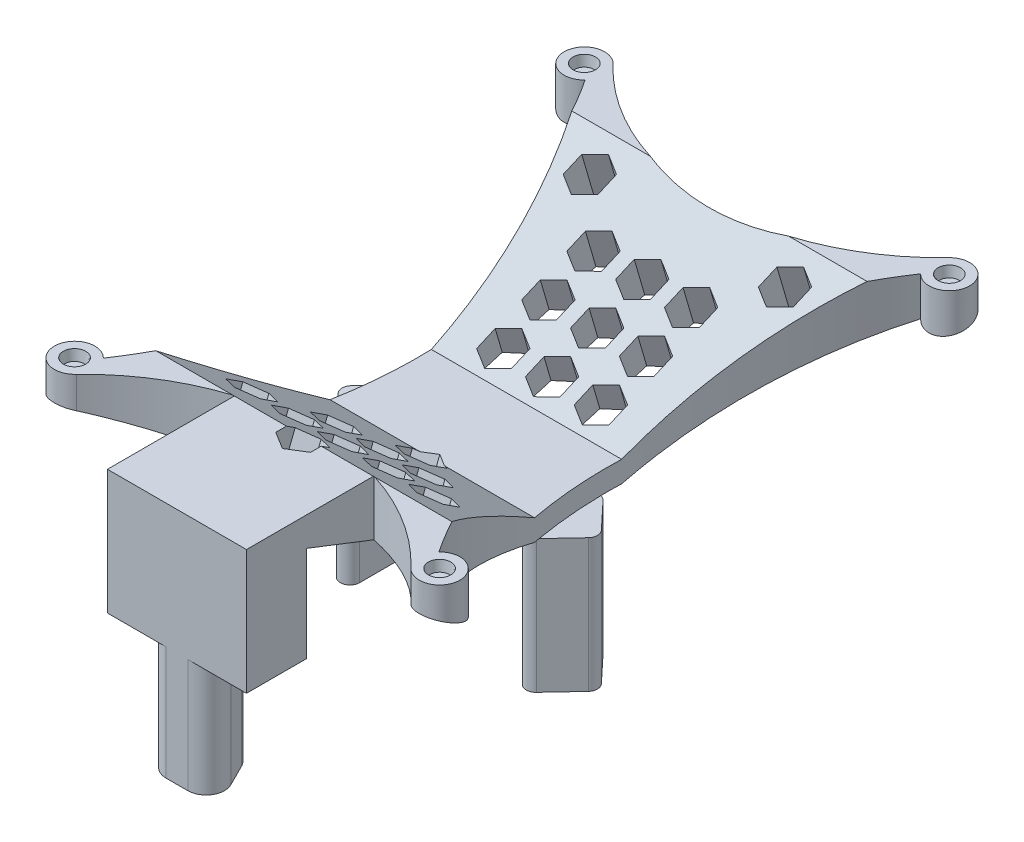
from build123d import *
from build123d.topology import SkipClean

# Parameters (mm, degrees)
BOSS_EXTRUDE1_DEPTH          = 36.5
CUT_EXTRUDE1_DEPTH           = 98.865031656
SKETCH4_R                    = 1.935
CUT_EXTRUDE2_DEPTH           = 1.7526
CUT_EXTRUDE2_DRAFT           = -8
CUT_EXTRUDE2_PROFILE_2_DEPTH = 1.7526
CUT_EXTRUDE2_PROFILE_2_DRAFT = -8
CUT_EXTRUDE2_PROFILE_3_DEPTH = 1.7526
CUT_EXTRUDE2_PROFILE_3_DRAFT = -8
CUT_EXTRUDE2_PROFILE_4_DEPTH = 1.7526
CUT_EXTRUDE2_PROFILE_4_DRAFT = -8
BOSS_EXTRUDE2_DEPTH          = 4.6228
FILLET1_R                    = 3.175
CUT_EXTRUDE4_START           = -15
CUT_EXTRUDE4_DEPTH           = 15
CUT_EXTRUDE6_DEPTH           = 50
CUT_EXTRUDE7_DEPTH           = 100
FILL_START                   = 16.923311585
FILL_PATTERN1_DEPTH          = 7.757240099
CUT_EXTRUDE8_DEPTH           = 100
FILL_START_2                 = 12.114170934
FILL_PATTERN2_DEPTH          = 8.855811696
BOSS_EXTRUDE4_DEPTH          = 22.982825762
FILLET2_R                    = 1.651


# Read off the part's stored shape, not the designer's step: Fill Pattern1, Fill Pattern2
with BuildPart() as part:
    # Sketch1 → Boss-Extrude1 (new body)
    with BuildSketch(Plane(origin=(0, 0, 0), x_dir=(1, 0, 0), z_dir=(0, 1, 0))):
        with BuildLine():
            Line((-12, -35.838693114), (-12, -57.838693114))
            Line((-12, -57.838693114), (12, -57.838693114))
            Line((12, -57.838693114), (12, -35.838693114))
            ThreePointArc((12, -35.838693114), (21.100135224, -40.014143909), (28.878256635, -46.318719847))
            ThreePointArc((28.878256635, -46.318719847), (34.99938562, -44.065576529), (28.966969845, -41.584682581))
            ThreePointArc((28.966969845, -41.584682581), (16.382626331, 0), (28.966969845, 41.584682581))
            ThreePointArc((28.966969845, 41.584682581), (34.998690641, 44.095727727), (28.838687388, 46.273194928))
            ThreePointArc((28.838687388, 46.273194928), (0, 33.991963114), (-28.838687388, 46.273194928))
            ThreePointArc((-28.838687388, 46.273194928), (-34.998690641, 44.095727727), (-28.966969845, 41.584682581))
            ThreePointArc((-28.966969845, 41.584682581), (-16.382626331, 0), (-28.966969845, -41.584682581))
            ThreePointArc((-28.966969845, -41.584682581), (-34.99938562, -44.065576529), (-28.878256635, -46.318719847))
            ThreePointArc((-28.878256635, -46.318719847), (-21.100135224, -40.014143909), (-12, -35.838693114))
        make_face()
    extrude(amount=BOSS_EXTRUDE1_DEPTH)

    # Sketch2 → Cut-Extrude1 (cut, through all)
    with BuildSketch(Plane(origin=(35, 0, 0), x_dir=(0, 0, -1), z_dir=(1, 0, 0))):
        Polygon((47.5, 31.5), (47.5, 18.360025762), (47.5, 0), (-3.679030534, 0), (-47.5, 0), (-47.5, 18.360025762), (-47.5, 31.5), (-13.761324108, 18.360025762), (2.5, 18.360025762), align=None)
    extrude(amount=-CUT_EXTRUDE1_DEPTH, mode=Mode.SUBTRACT)


with BuildPart() as cut_extrude2_tool:
    # Sketch4 → Cut-Extrude2 (with draft: the straight prism first)
    with BuildSketch(Plane(origin=(0, 36.5, 0), x_dir=(1, 0, 0), z_dir=(0, 1, 0))):
        with Locations((31.5, 44)):
            Circle(SKETCH4_R)
    extrude(amount=-CUT_EXTRUDE2_DEPTH)
    # Cut-Extrude2: the draft: its side faces are tilted about the plane it starts from
    cut_extrude2_sides = [cut_extrude2_tool.faces().sort_by_distance(p)[0] for p in [
        (29.565, 35.6237, -44),
    ]]
    draft(cut_extrude2_sides, Plane(origin=(0, 36.5, 0), x_dir=(1, 0, 0), z_dir=(0, 1, 0)), CUT_EXTRUDE2_DRAFT)


with BuildPart() as part_1:
    add(part.part)

    # Cut-Extrude2: cut by cut_extrude2_tool
    add(cut_extrude2_tool.part, mode=Mode.SUBTRACT)


with BuildPart() as cut_extrude2_profile_2_tool:
    # Sketch4 → Cut-Extrude2 profile 2 (with draft: the straight prism first)
    with BuildSketch(Plane(origin=(0, 36.5, 0), x_dir=(1, 0, 0), z_dir=(0, 1, 0))):
        with Locations((-31.522, 44)):
            Circle(SKETCH4_R)
    extrude(amount=-CUT_EXTRUDE2_PROFILE_2_DEPTH)
    # Cut-Extrude2 profile 2: the draft: its side faces are tilted about the plane it starts from
    cut_extrude2_profile_2_sides = [cut_extrude2_profile_2_tool.faces().sort_by_distance(p)[0] for p in [
        (-33.457, 35.6237, -44),
    ]]
    draft(cut_extrude2_profile_2_sides, Plane(origin=(0, 36.5, 0), x_dir=(1, 0, 0), z_dir=(0, 1, 0)), CUT_EXTRUDE2_PROFILE_2_DRAFT)


with BuildPart() as part_2:
    add(part_1.part)

    # Cut-Extrude2 profile 2: cut by cut_extrude2_profile_2_tool
    add(cut_extrude2_profile_2_tool.part, mode=Mode.SUBTRACT)


with BuildPart() as cut_extrude2_profile_3_tool:
    # Sketch4 → Cut-Extrude2 profile 3 (with draft: the straight prism first)
    with BuildSketch(Plane(origin=(0, 36.5, 0), x_dir=(1, 0, 0), z_dir=(0, 1, 0))):
        with Locations((-31.522, -44)):
            Circle(SKETCH4_R)
    extrude(amount=-CUT_EXTRUDE2_PROFILE_3_DEPTH)
    # Cut-Extrude2 profile 3: the draft: its side faces are tilted about the plane it starts from
    cut_extrude2_profile_3_sides = [cut_extrude2_profile_3_tool.faces().sort_by_distance(p)[0] for p in [
        (-33.457, 35.6237, 44),
    ]]
    draft(cut_extrude2_profile_3_sides, Plane(origin=(0, 36.5, 0), x_dir=(1, 0, 0), z_dir=(0, 1, 0)), CUT_EXTRUDE2_PROFILE_3_DRAFT)


with BuildPart() as part_3:
    add(part_2.part)

    # Cut-Extrude2 profile 3: cut by cut_extrude2_profile_3_tool
    add(cut_extrude2_profile_3_tool.part, mode=Mode.SUBTRACT)


with BuildPart() as cut_extrude2_profile_4_tool:
    # Sketch4 → Cut-Extrude2 profile 4 (with draft: the straight prism first)
    with BuildSketch(Plane(origin=(0, 36.5, 0), x_dir=(1, 0, 0), z_dir=(0, 1, 0))):
        with Locations((31.5, -44)):
            Circle(SKETCH4_R)
    extrude(amount=-CUT_EXTRUDE2_PROFILE_4_DEPTH)
    # Cut-Extrude2 profile 4: the draft: its side faces are tilted about the plane it starts from
    cut_extrude2_profile_4_sides = [cut_extrude2_profile_4_tool.faces().sort_by_distance(p)[0] for p in [
        (29.565, 35.6237, 44),
    ]]
    draft(cut_extrude2_profile_4_sides, Plane(origin=(0, 36.5, 0), x_dir=(1, 0, 0), z_dir=(0, 1, 0)), CUT_EXTRUDE2_PROFILE_4_DRAFT)


with BuildPart() as part_4:
    add(part_3.part)

    # Cut-Extrude2 profile 4: cut by cut_extrude2_profile_4_tool
    add(cut_extrude2_profile_4_tool.part, mode=Mode.SUBTRACT)

    # Sketch9 → Boss-Extrude2 (add)
    with BuildSketch(Plane.XZ):
        Polygon((7, 57.838693114), (-7, 57.838693114), (0, 43.838693114), align=None)
    extrude(amount=BOSS_EXTRUDE2_DEPTH)

    # Fillet1
    # the kernel refuses this fillet: 3.175 mm, written as the material it takes off along each edge
    with BuildSketch(Plane(origin=(0, 0, 43.838693114), x_dir=(0.44721359549995787, 0, 0.8944271909999159), z_dir=(0, -1, 0))) as fillet1_piece_1:
        with BuildLine():
            CenterArc((FILLET1_R * 2, FILLET1_R), FILLET1_R, 143.130102354, 126.869897646)
            Line((FILLET1_R * 1.2, FILLET1_R * 1.6), (0, 0))
            Line((0, 0), (FILLET1_R * 2, 0))
        make_face()
    extrude(amount=20.4978, mode=Mode.SUBTRACT)
    with BuildSketch(Plane(origin=(7, 0, 57.838693114), x_dir=(-1, 0, 0), z_dir=(0, -1, 0))) as fillet1_piece_2:
        with BuildLine():
            CenterArc((FILLET1_R * 1.61803398875, FILLET1_R), FILLET1_R, 153.434948823, 116.565051177)
            Line((FILLET1_R * 0.72360679775, FILLET1_R * 1.4472135955), (0, 0))
            Line((0, 0), (FILLET1_R * 1.61803398875, 0))
        make_face()
    extrude(amount=17.465944786, mode=Mode.SUBTRACT)
    with BuildSketch(Plane(origin=(-7, 0, 57.838693114), x_dir=(1, 0, 0), z_dir=(0, -1, 0))) as fillet1_piece_3:
        with BuildLine():
            CenterArc((FILLET1_R * 1.61803398875, -FILLET1_R), FILLET1_R, 90, 116.565051177)
            Line((FILLET1_R * 0.72360679775, -FILLET1_R * 1.4472135955), (0, 0))
            Line((0, 0), (FILLET1_R * 1.61803398875, 0))
        make_face()
    extrude(amount=17.465944786, mode=Mode.SUBTRACT)

    # Sketch23 → Cut-Extrude4 (cut)
    with SkipClean():  # the faces are left unmerged after this step: merging them gives an invalid solid
        with BuildSketch(Plane.XZ.offset(CUT_EXTRUDE4_START)):
            with BuildLine():
                ThreePointArc((1.862742086, 57.838693114), (4.563558402, 56.332889395), (4.702548417, 53.243789948))
                Line((4.702548417, 53.243789948), (2.839806331, 49.518305777))
                ThreePointArc((2.839806331, 49.518305777), (0, 47.763208942), (-2.839806331, 49.518305777))
                Line((-2.839806331, 49.518305777), (-4.702548417, 53.243789948))
                ThreePointArc((-4.702548417, 53.243789948), (-4.563558402, 56.332889395), (-1.862742086, 57.838693114))
                Line((-1.862742086, 57.838693114), (-12, 57.838693114))
                Line((-12, 57.838693114), (-12, 47.5))
                Line((-12, 47.5), (12, 47.5))
                Line((12, 47.5), (12, 57.838693114))
                Line((12, 57.838693114), (1.862742086, 57.838693114))
            make_face()
        extrude(amount=CUT_EXTRUDE4_DEPTH, mode=Mode.SUBTRACT)

    # Sketch15 → Cut-Extrude6 (cut, symmetric)
    with BuildSketch(Plane(origin=(-12.359159139, 18.360025762, 1.236220339), x_dir=(0, 0, 1), z_dir=(-1, 0, 0))):
        Polygon((-37.052321788, 18.139974238), (-3.736220339, 3.674033336), (12.525103769, 3.674033336), (34.69981047, 18.139974238), align=None)
    extrude(amount=CUT_EXTRUDE6_DEPTH, both=True, mode=Mode.SUBTRACT)

    # Sketch25 → Cut-Extrude7 (cut)
    with BuildSketch(Plane(origin=(0, 16.244925312, 4.743508891), x_dir=(-1, 0, 0), z_dir=(0, -0.9599140942773268, -0.28029436599357355))):
        Polygon((0, 9.894732418), (3, 11.626783225), (3, 15.09088484), (0, 16.822935648), (-3, 15.09088484), (-3, 11.626783225), align=None)
    extrude(amount=-CUT_EXTRUDE7_DEPTH, mode=Mode.SUBTRACT)

    # Fill Pattern1 outline → Fill Pattern1 (cut)
    with BuildSketch(Plane(origin=(0, 0, 0), x_dir=(1, 0, 0), z_dir=(0, 0.9599140942773268, 0.2802943659935737)).offset(FILL_START)):
        Polygon((0, 26.744253388), (3, 28.476304195), (3, 31.940405811), (0, 33.672456618), (-3, 31.940405811), (-3, 28.476304195), align=None)
        Polygon((0, 18.319492903), (3, 20.05154371), (3, 23.515645326), (0, 25.247696133), (-3, 23.515645326), (-3, 20.05154371), align=None)
        Polygon((5.424760485, 11.626783225), (8.424760485, 9.894732418), (11.424760485, 11.626783225), (11.424760485, 15.09088484), (8.424760485, 16.822935648), (5.424760485, 15.09088484), align=None)
        Polygon((8.424760485, 26.744253388), (11.424760485, 28.476304195), (11.424760485, 31.940405811), (8.424760485, 33.672456618), (5.424760485, 31.940405811), (5.424760485, 28.476304195), align=None)
        Polygon((8.424760485, 18.319492903), (11.424760485, 20.05154371), (11.424760485, 23.515645326), (8.424760485, 25.247696133), (5.424760485, 23.515645326), (5.424760485, 20.05154371), align=None)
        Polygon((-11.424760485, 28.476304195), (-8.424760485, 26.744253388), (-5.424760485, 28.476304195), (-5.424760485, 31.940405811), (-8.424760485, 33.672456618), (-11.424760485, 31.940405811), align=None)
        Polygon((-8.424760485, 18.319492903), (-5.424760485, 20.05154371), (-5.424760485, 23.515645326), (-8.424760485, 25.247696133), (-11.424760485, 23.515645326), (-11.424760485, 20.05154371), align=None)
        Polygon((-8.424760485, 9.894732418), (-5.424760485, 11.626783225), (-5.424760485, 15.09088484), (-8.424760485, 16.822935648), (-11.424760485, 15.09088484), (-11.424760485, 11.626783225), align=None)
        Polygon((13.84952097, 36.90106468), (16.84952097, 35.169013873), (19.84952097, 36.90106468), (19.84952097, 40.365166296), (16.84952097, 42.097217103), (13.84952097, 40.365166296), align=None)
        Polygon((-19.84952097, 36.90106468), (-16.84952097, 35.169013873), (-13.84952097, 36.90106468), (-13.84952097, 40.365166296), (-16.84952097, 42.097217103), (-19.84952097, 40.365166296), align=None)
    extrude(amount=FILL_PATTERN1_DEPTH, mode=Mode.SUBTRACT)

    # Sketch26 → Cut-Extrude8 (cut)
    with SkipClean():  # the faces are left unmerged after this step: merging them gives an invalid solid
        with BuildSketch(Plane(origin=(0, 11.288272361, -4.396367198), x_dir=(1, 0, 0), z_dir=(0, -0.9318237642182001, 0.36291110817695343))):
            Polygon((0, 26.535681859), (-3, 24.803631051), (-3, 21.339529436), (0, 19.607478629), (3, 21.339529436), (3, 24.803631051), align=None)
        extrude(amount=-CUT_EXTRUDE8_DEPTH, mode=Mode.SUBTRACT)

    # Fill Pattern2 outline → Fill Pattern2 (cut)
    with SkipClean():  # the faces are left unmerged after this step: merging them gives an invalid solid
        with BuildSketch(Plane(origin=(0, 0, 0), x_dir=(1, 0, 0), z_dir=(0, 0.9318237642182, -0.3629111081769533)).offset(FILL_START_2)):
            Polygon((0, -42.297607089), (3, -40.565556281), (3, -37.101454666), (0, -35.369403859), (-3, -37.101454666), (-3, -40.565556281), align=None)
            Polygon((0, -50.178569704), (3, -48.446518896), (3, -44.982417281), (0, -43.250366474), (-3, -44.982417281), (-3, -48.446518896), align=None)
            Polygon((0, -34.416644474), (3, -32.684593666), (3, -29.220492051), (0, -27.488441244), (-3, -29.220492051), (-3, -32.684593666), align=None)
            Polygon((4.880962615, -32.684593666), (7.880962615, -34.416644474), (10.880962615, -32.684593666), (10.880962615, -29.220492051), (7.880962615, -27.488441244), (4.880962615, -29.220492051), align=None)
            Polygon((7.880962615, -42.297607089), (10.880962615, -40.565556281), (10.880962615, -37.101454666), (7.880962615, -35.369403859), (4.880962615, -37.101454666), (4.880962615, -40.565556281), align=None)
            Polygon((-10.880962615, -40.565556281), (-7.880962615, -42.297607089), (-4.880962615, -40.565556281), (-4.880962615, -37.101454666), (-7.880962615, -35.369403859), (-10.880962615, -37.101454666), align=None)
            Polygon((-7.880962615, -34.416644474), (-4.880962615, -32.684593666), (-4.880962615, -29.220492051), (-7.880962615, -27.488441244), (-10.880962615, -29.220492051), (-10.880962615, -32.684593666), align=None)
            Polygon((12.76192523, -40.565556281), (15.76192523, -42.297607089), (18.76192523, -40.565556281), (18.76192523, -37.101454666), (15.76192523, -35.369403859), (12.76192523, -37.101454666), align=None)
            Polygon((-18.76192523, -40.565556281), (-15.76192523, -42.297607089), (-12.76192523, -40.565556281), (-12.76192523, -37.101454666), (-15.76192523, -35.369403859), (-18.76192523, -37.101454666), align=None)
        extrude(amount=FILL_PATTERN2_DEPTH, mode=Mode.SUBTRACT)

    # Sketch27 → Boss-Extrude4 (add)
    with SkipClean():  # the faces are left unmerged after this step: merging them gives an invalid solid
        with BuildSketch(Plane.XZ.offset(-18.360025762)):
            Polygon((-14.39545, 16.093993162), (-22.654563, 7.292693114), (-14.39545, -1.508606934), align=None)
            Polygon((14.39545, -1.508606934), (14.39545, 16.093993162), (22.654563, 7.292693114), align=None)
        extrude(amount=BOSS_EXTRUDE4_DEPTH)

    # Fillet2
    # the kernel refuses this fillet: 1.651 mm, written as the material it takes off along each edge
    with BuildSketch(Plane(origin=(-14.39545, 18.360025762, -1.508606934), x_dir=(-0.6842891554469595, -3.88953273050987e-15, 0.7292107731909114), z_dir=(0, -1, 0)), Plane(origin=(-14.39545, 18.360025762, 16.093993162), x_dir=(0, 0, -1), z_dir=(0, -1, 0)), Plane(origin=(14.39545, 18.360025762, -1.508606934), x_dir=(0, 0, 1), z_dir=(0, -1, 0))) as fillet2_piece_1:
        with BuildLine():
            CenterArc((FILLET2_R * 2.52701764952, -FILLET2_R), FILLET2_R, 90, 136.820271132)
            Line((FILLET2_R * 1.84272849407, -FILLET2_R * 1.72921077319), (0, 0))
            Line((0, 0), (FILLET2_R * 2.52701764952, 0))
        make_face()
    extrude(amount=33.41309111, mode=Mode.SUBTRACT)
    with BuildSketch(Plane(origin=(-22.654563, 22.233259116, 7.292693114), x_dir=(0.684289155446959, 3.889532730509872e-15, -0.7292107731909118), z_dir=(0, -1, 0))) as fillet2_piece_2:
        with BuildLine():
            CenterArc((FILLET2_R * 0.938396936256, FILLET2_R), FILLET2_R, 183.640542265, 86.359457735)
            Line((-FILLET2_R * 0.0595851120036, FILLET2_R * 0.936503296525), (0, 0))
            Line((0, 0), (FILLET2_R * 0.938396936256, 0))
        make_face()
    extrude(amount=30.729292471, mode=Mode.SUBTRACT)
    with BuildSketch(Plane(origin=(22.654563, 22.233259116, 7.292693114), x_dir=(-0.6842891554469595, 3.889532730509871e-15, -0.7292107731909117), z_dir=(0, -1, 0))) as fillet2_piece_3:
        with BuildLine():
            CenterArc((FILLET2_R * 0.938396936256, -FILLET2_R), FILLET2_R, 90, 86.359457735)
            Line((-FILLET2_R * 0.0595851120036, -FILLET2_R * 0.936503296525), (0, 0))
            Line((0, 0), (FILLET2_R * 0.938396936256, 0))
        make_face()
    extrude(amount=30.729292471, mode=Mode.SUBTRACT)
    with BuildSketch(Plane(origin=(14.39545, 18.360025762, 16.093993162), x_dir=(0, 0, -1), z_dir=(0, -1, 0))) as fillet2_piece_4:
        with BuildLine():
            CenterArc((FILLET2_R * 2.52701764952, FILLET2_R), FILLET2_R, 133.179728868, 136.820271132)
            Line((FILLET2_R * 1.84272849407, FILLET2_R * 1.72921077319), (0, 0))
            Line((0, 0), (FILLET2_R * 2.52701764952, 0))
        make_face()
    extrude(amount=33.41309111, mode=Mode.SUBTRACT)


solid = part_4.part
